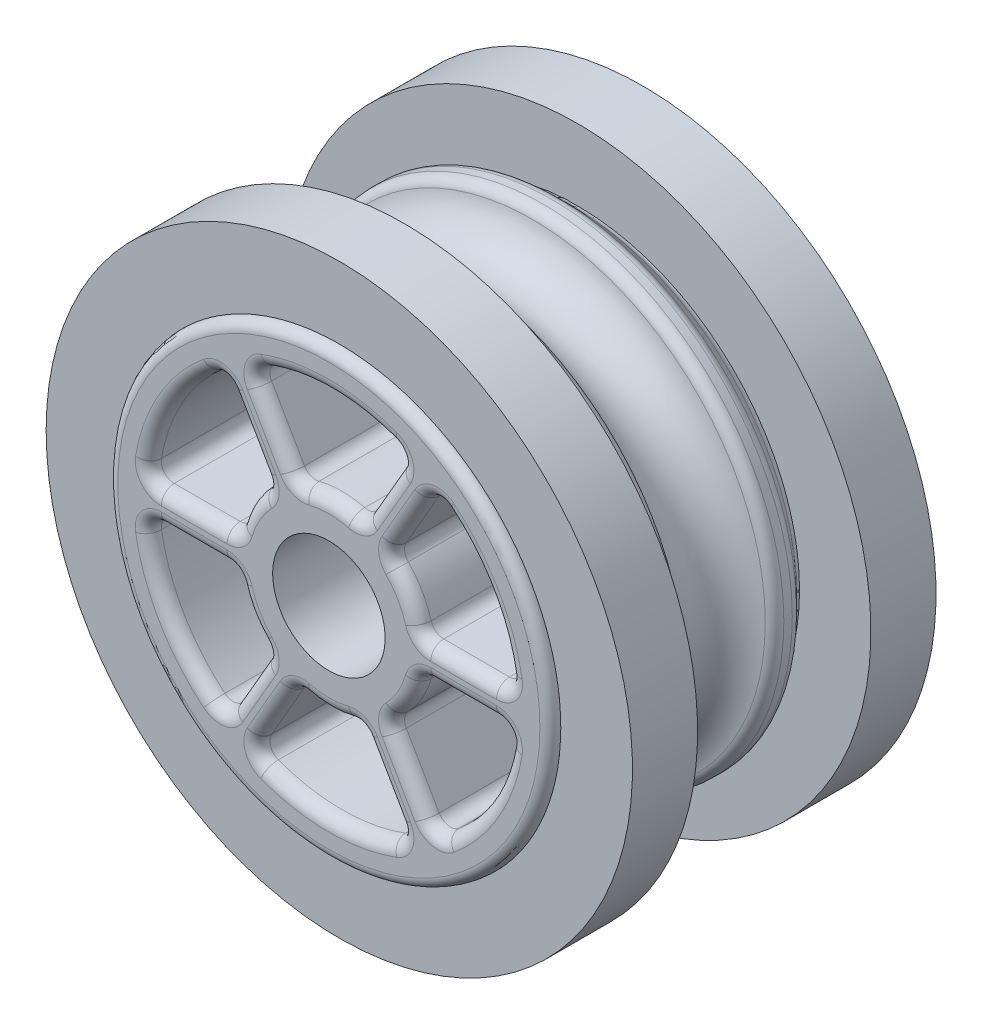
from build123d import *

# Parameters (mm, degrees)
CHAMFER1_SIZE      = 2
CUT_EXTRUDE1_DEPTH = 37.118001052
CIRPATTERN1_COUNT  = 6
FILLET2_R          = 0.8
FILLET4_R          = 0.8
FILLET5_R          = 1
SKETCH3_W          = 5
SKETCH3_H          = 5.5


with BuildPart() as part:
    # Sketch1 → Revolve1 (revolve)
    with BuildSketch(Plane(origin=(0, 0, 0), x_dir=(0, 0, -1), z_dir=(1, 0, 0)), mode=Mode.PRIVATE) as revolve1_sk:
        with BuildLine():
            Line((-12.45, 4.318), (12.45, 4.318))
            Line((12.45, 4.318), (12.45, 17))
            Line((12.45, 17), (4.45, 17))
            Line((4.45, 17), (4.45, 18.5))
            Line((4.45, 18.5), (3.25, 18.5))
            ThreePointArc((3.25, 18.5), (0, 15.25), (-3.25, 18.5))
            Line((-3.25, 18.5), (-4.45, 18.5))
            Line((-4.45, 18.5), (-4.45, 17))
            Line((-4.45, 17), (-12.45, 17))
            Line((-12.45, 17), (-12.45, 4.318))
        make_face()
    revolve(revolve1_sk.sketch.rotate(Axis((0, 0, 0), (0, 0, 1)), 90), axis=Axis((0, 0, 0), (0, 0, 1)))

    # Chamfer1
    # the kernel refuses this chamfer: 2 mm, written as the material it adds along each edge
    with BuildSketch(Plane(origin=(0, 0, -4.45), x_dir=(-1, 0, 0), z_dir=(0, 1, 0))) as chamfer1_piece_1_section:
        Polygon((17, -CHAMFER1_SIZE), (17 + CHAMFER1_SIZE, 0), (17, 0), align=None)
    chamfer1_piece_1 = revolve(axis=Axis((0, 0, -4.45), (0, 0, 1)), mode=Mode.PRIVATE)
    chamfer1_piece_1 = chamfer1_piece_1 & Plane(origin=(0, 0, -5.685294558), x_dir=(-1, 0, 0), z_dir=(0, 0, 1)) * Cylinder(18.5, 76, mode=Mode.PRIVATE)
    add(chamfer1_piece_1)
    with BuildSketch(Plane(origin=(0, 0, 4.45), x_dir=(-1, 0, 0), z_dir=(0, 1, 0))) as chamfer1_piece_2_section:
        Polygon((17 + CHAMFER1_SIZE, 0), (17, CHAMFER1_SIZE), (17, 0), align=None)
    chamfer1_piece_2 = revolve(axis=Axis((0, 0, 4.45), (0, 0, 1)), mode=Mode.PRIVATE)
    chamfer1_piece_2 = chamfer1_piece_2 & Plane(origin=(0, 0, 5.685294558), x_dir=(-1, 0, 0), z_dir=(0, 0, 1)) * Cylinder(18.5, 76, mode=Mode.PRIVATE)
    add(chamfer1_piece_2)

    # Sketch2 → Cut-Extrude1 (cut, through all)
    with BuildSketch(Plane.XY.offset(12.45)):
        with BuildLine():
            Line((-2.468828951, 6.676137178), (-5.960099841, 12.723195742))
            ThreePointArc((-5.960099841, 12.723195742), (0, 14.05), (5.960099841, 12.723195742))
            Line((5.960099841, 12.723195742), (2.468828951, 6.676137178))
            ThreePointArc((2.468828951, 6.676137178), (0, 7.118), (-2.468828951, 6.676137178))
        make_face()
    cut_extrude1 = extrude(amount=-CUT_EXTRUDE1_DEPTH, mode=Mode.SUBTRACT)

    # CirPattern1: Cut-Extrude1 ×6 about axis
    cirpattern1_axis = Axis((0, 0, 0), (0, 0, 1))
    for i in range(1, CIRPATTERN1_COUNT):
        add(cut_extrude1.rotate(cirpattern1_axis, i * 360 / CIRPATTERN1_COUNT), mode=Mode.SUBTRACT)

    # Fillet2
    fillet2_edges = [part.edges().sort_by_distance(p)[0] for p in [
        (17, 0, -6.45),
        (17, 0, 6.45),
        (18.5, 0, -4.95),
        (18.5, 0, 4.95),
        (18.5, 0, -3.25),
        (18.5, 0, 3.25),
    ]]
    fillet(fillet2_edges, radius=FILLET2_R)

    # Fillet4
    fillet4_edges = [part.edges().sort_by_distance(p)[0] for p in [
        (17, 0, 12.45),
        (17, 0, -12.45),
    ]]
    fillet(fillet4_edges, radius=FILLET4_R)

    # Fillet5
    fillet5_edges = [part.edges().sort_by_distance(p)[0] for p in [
        (0, 14.05, -12.45),
        (-5.960099841, 12.723195742, 0),
        (4.214464396, 9.69966646, -12.45),
        (5.960099841, 12.723195742, 0),
        (0, 7.118, -12.45),
        (2.468828951, 6.676137178, 0),
        (-4.214464396, 9.69966646, -12.45),
        (-2.468828951, 6.676137178, 0),
        (0, 14.05, 12.45),
        (-4.214464396, 9.69966646, 12.45),
        (0, 7.118, 12.45),
        (4.214464396, 9.69966646, 12.45),
        (12.167656923, 7.025, -12.45),
        (8.03856081, 11.523195742, 0),
        (10.50738976, 1.2, -12.45),
        (13.99866065, 1.2, 0),
        (6.164368824, 3.559, -12.45),
        (7.01611887, 1.2, 0),
        (6.292925365, 8.49966646, -12.45),
        (4.54728992, 5.476137178, 0),
        (12.167656923, 7.025, 12.45),
        (6.292925365, 8.49966646, 12.45),
        (6.164368824, 3.559, 12.45),
        (10.50738976, 1.2, 12.45),
        (-12.167656923, 7.025, -12.45),
        (-13.99866065, 1.2, 0),
        (-6.292925365, 8.49966646, -12.45),
        (-8.03856081, 11.523195742, 0),
        (-6.164368824, 3.559, -12.45),
        (-4.54728992, 5.476137178, 0),
        (-10.50738976, 1.2, -12.45),
        (-7.01611887, 1.2, 0),
        (-12.167656923, 7.025, 12.45),
        (-10.50738976, 1.2, 12.45),
        (-6.164368824, 3.559, 12.45),
        (-6.292925365, 8.49966646, 12.45),
        (-12.167656923, -7.025, -12.45),
        (-8.03856081, -11.523195742, 0),
        (-10.50738976, -1.2, -12.45),
        (-13.99866065, -1.2, 0),
        (-6.164368824, -3.559, -12.45),
        (-7.01611887, -1.2, 0),
        (-6.292925365, -8.49966646, -12.45),
        (-4.54728992, -5.476137178, 0),
        (-12.167656923, -7.025, 12.45),
        (-6.292925365, -8.49966646, 12.45),
        (-6.164368824, -3.559, 12.45),
        (-10.50738976, -1.2, 12.45),
        (12.167656923, -7.025, -12.45),
        (13.99866065, -1.2, 0),
        (6.292925365, -8.49966646, -12.45),
        (8.03856081, -11.523195742, 0),
        (6.164368824, -3.559, -12.45),
        (4.54728992, -5.476137178, 0),
        (10.50738976, -1.2, -12.45),
        (7.01611887, -1.2, 0),
        (12.167656923, -7.025, 12.45),
        (10.50738976, -1.2, 12.45),
        (6.164368824, -3.559, 12.45),
        (6.292925365, -8.49966646, 12.45),
        (0, -14.05, -12.45),
        (5.960099841, -12.723195742, 0),
        (-4.214464396, -9.69966646, -12.45),
        (-5.960099841, -12.723195742, 0),
        (0, -7.118, -12.45),
        (-2.468828951, -6.676137178, 0),
        (4.214464396, -9.69966646, -12.45),
        (2.468828951, -6.676137178, 0),
        (0, -14.05, 12.45),
        (4.214464396, -9.69966646, 12.45),
        (0, -7.118, 12.45),
        (-4.214464396, -9.69966646, 12.45),
    ]]
    fillet(fillet5_edges, radius=FILLET5_R)


with BuildPart() as body_2:
    # Sketch3 → Revolve2 (revolve)
    with BuildSketch(Plane(origin=(0, 0, 0), x_dir=(0, 0, -1), z_dir=(1, 0, 0)), mode=Mode.PRIVATE) as revolve2_sk:
        with Locations((-9.15, 19.75)):
            Rectangle(SKETCH3_W, SKETCH3_H)
        with Locations((9.15, 19.75)):
            Rectangle(SKETCH3_W, SKETCH3_H)
    revolve(revolve2_sk.sketch.rotate(Axis((0, 0, 0), (0, 0, 1)), 270), axis=Axis((0, 0, 0), (0, 0, 1)))


solid = Compound([part.part, body_2.part])
